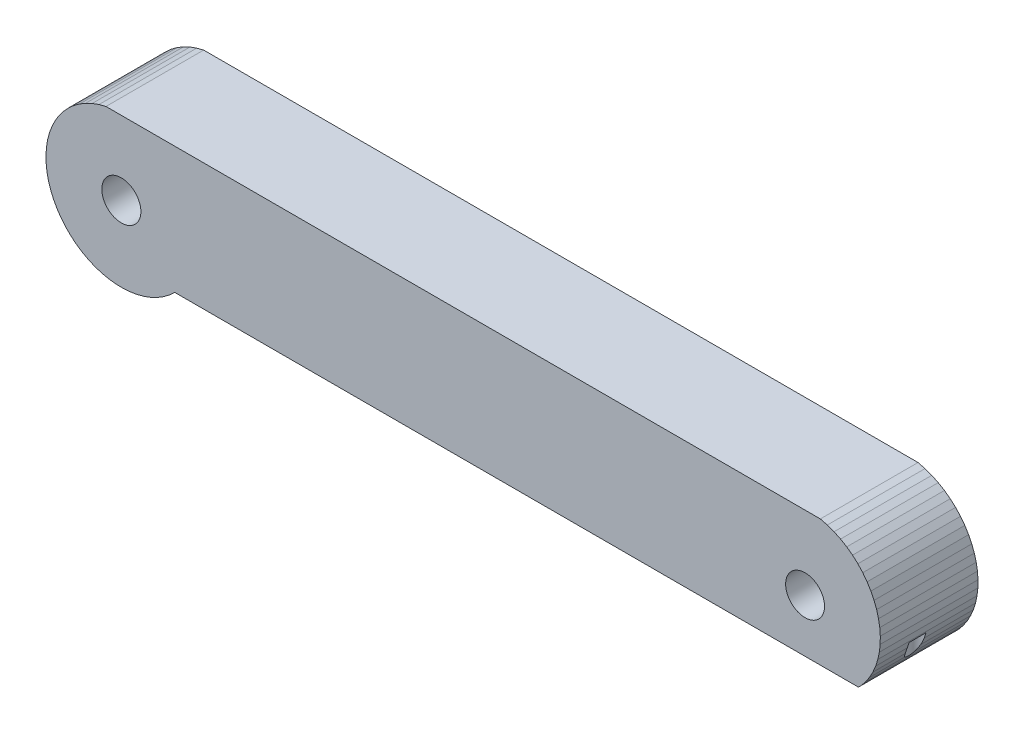
from build123d import *
from OCP.BRepAlgoAPI import BRepAlgoAPI_Cut
from OCP.TopTools import TopTools_ListOfShape

# Parameters (mm, degrees)
BOSS_EXTRUDE1_DEPTH      = 19.999999553
CUT_EXTRUDE1_DEPTH       = 158.4379932
CUT_EXTRUDE2_DEPTH       = 158.4379932
SKETCH7_W                = 17.271465807
SKETCH7_H                = 13.849760317
SKETCH7_W_2              = 14.338575387
SKETCH7_H_2              = 12.546253463
BOSS_EXTRUDE4_DEPTH      = 20
SKETCH6_R                = 3.997536833
SKETCH6_R_2              = 3.982936498
CUT_EXTRUDE4_DEPTH       = 20
SPLIT1_SURFACE_1_BACK    = 175.651
SPLIT1_SURFACE_1_DEPTH   = 351.302
SPLIT1_SURFACE_2_BACK    = 175.651
SPLIT1_SURFACE_2_DEPTH   = 351.302
BODY_DELETE_KEEP_3_DEPTH = 19.999999553
SKETCH15_R               = 1.744345672
CUT_EXTRUDE8_DEPTH       = 6.604
SKETCH18_R               = 1.524
CUT_EXTRUDE10_DEPTH      = 6.604
SKETCH21_R               = 1.524
CUT_EXTRUDE12_DEPTH      = 6.604


with BuildPart() as part:
    # Sketch1 → Boss-Extrude1 (new body)
    with BuildSketch(Plane.XY.offset(19.999999553)):
        Polygon((-147.262692451, 13.588201255), (-148.526370525, 12.833039276), (-149.712219834, 11.960721575), (-150.809392333, 10.979211889), (-151.807874441, 9.897469543), (-152.69857645, 8.725371212), (-153.473347425, 7.473616395), (-154.125109315, 6.153633818), (-154.647916555, 4.777472466), (-155.037015676, 3.357697045), (-155.2888304, 1.907268073), (-155.401065946, 0.439427269), (-155.372709036, -1.032425207), (-155.203998089, -2.494852291), (-154.896497726, -3.934503533), (-154.453009367, -5.338235293), (-153.877556324, -6.69323327), (-153.175413609, -7.987127639), (-152.353018522, -9.208105505), (-151.417821646, -10.3450194), (-150.378391147, -11.387491599), (-149.244219065, -12.326003984), (-148.025646806, -13.15199025), (-146.733820438, -13.857908547), (-145.38051188, -14.437315054), (-143.978089094, -14.884918928), (-142.539337277, -15.196635388), (-141.077414155, -15.36961738), (-139.605656266, -15.402286313), (-138.137474656, -15.294345096), (-136.686325073, -15.046778135), (-135.265409946, -14.661843888), (-133.887723088, -14.143059961), (-132.565841079, -13.495159335), (-131.311833858, -12.724057771), (-130.137130618, -11.836796999), (-129.052475095, -10.841473937), (-10.947530158, -10.841473937), (-9.862869047, -11.836796999), (-8.688169532, -12.724057771), (-7.434152998, -13.495159335), (-6.112268195, -14.143059961), (-4.734582733, -14.661843888), (-3.313674591, -15.046778135), (-1.862514997, -15.294345096), (-0.394351926, -15.402286313), (1.077411231, -15.36961738), (2.539338311, -15.196635388), (3.978083376, -14.884918928), (5.380511284, -14.437315054), (6.733819377, -13.857908547), (8.025652729, -13.15199025), (9.244217537, -12.326003984), (10.378391482, -11.387491599), (11.417816393, -10.3450194), (12.35300675, -9.208105505), (13.175422326, -7.987127639), (13.877556659, -6.69323327), (14.453000389, -5.338235293), (14.896498062, -3.934503533), (15.204001218, -2.494852291), (15.372704715, -1.032425207), (15.401067212, 0.439427269), (15.288828872, 1.907268073), (15.03701508, 3.357697045), (14.647925273, 4.777472466), (14.125110582, 6.153633818), (13.473344967, 7.473616395), (12.698576786, 8.725371212), (11.807881296, 9.897469543), (10.809388012, 10.979211889), (9.71221365, 11.960721575), (8.526373655, 12.833039276), (7.262694649, 13.588201255), (5.932712927, 14.21931386), (4.548569676, 14.720613137), (3.122901777, 15.087526292), (-143.122896552, 15.087526292), (-144.548565149, 14.720613137), (-145.93270421, 14.21931386), align=None)
    extrude(amount=-BOSS_EXTRUDE1_DEPTH)

    # Sketch2 → Cut-Extrude1 (cut, through all)
    with BuildSketch(Plane(origin=(0, 0, 0), x_dir=(-1, 0, 0), z_dir=(0, 0, -1))):
        Polygon((138.905346394, 3.847302636), (138.217046857, 3.580653109), (137.589469552, 3.192068776), (137.043967843, 2.694782568), (136.599138379, 2.105728723), (136.270105839, 1.444966649), (136.068105698, 0.73499803), (136.000007391, 0), (136.068105698, -0.73499803), (136.270105839, -1.444966649), (136.599138379, -2.105728723), (137.043967843, -2.694782568), (137.589469552, -3.192068776), (138.217046857, -3.580653109), (138.905346394, -3.847302636), (139.630913734, -3.982936498), (140.369072556, -3.982936498), (141.094654799, -3.847302636), (141.782954335, -3.580653109), (142.41053164, -3.192068776), (142.956033349, -2.694782568), (143.400862813, -2.105728723), (143.729895353, -1.444966649), (143.931895494, -0.73499803), (143.999993801, 0), (143.931895494, 0.73499803), (143.729895353, 1.444966649), (143.400862813, 2.105728723), (142.956033349, 2.694782568), (142.41053164, 3.192068776), (141.782954335, 3.580653109), (141.094654799, 3.847302636), (140.369072556, 3.982936498), (139.630913734, 3.982936498), align=None)
    extrude(amount=-CUT_EXTRUDE1_DEPTH, mode=Mode.SUBTRACT)

    # Sketch3 → Cut-Extrude2 (cut, through all)
    with BuildSketch(Plane(origin=(0, 0, 0), x_dir=(-1, 0, 0), z_dir=(0, 0, -1))):
        Polygon((-2.956035547, 2.694782568), (-3.400868736, 2.105728723), (-3.729888937, 1.444966649), (-3.93189257, 0.73499803), (-4.00000019, 0), (-3.93189257, -0.73499803), (-3.729888937, -1.444966649), (-3.400868736, -2.105728723), (-2.956035547, -2.694782568), (-2.410538495, -3.192068776), (-1.78295339, -3.580653109), (-1.094651991, -3.847302636), (-0.369073445, -3.982936498), (0.369073445, -3.982936498), (1.094651991, -3.847302636), (1.78295339, -3.580653109), (2.410538495, -3.192068776), (2.956035547, -2.694782568), (3.400868736, -2.105728723), (3.729888937, -1.444966649), (3.93189257, -0.73499803), (4.00000019, 0), (3.93189257, 0.73499803), (3.729888937, 1.444966649), (3.400868736, 2.105728723), (2.956035547, 2.694782568), (2.410538495, 3.192068776), (1.78295339, 3.580653109), (1.094651991, 3.847302636), (0.369073445, 3.982936498), (-0.369073445, 3.982936498), (-1.094651991, 3.847302636), (-1.78295339, 3.580653109), (-2.410538495, 3.192068776), align=None)
    extrude(amount=-CUT_EXTRUDE2_DEPTH, mode=Mode.SUBTRACT)

    # Sketch7 → Boss-Extrude4 (add)
    with BuildSketch(Plane.XY):
        with Locations((-138.922924236, -1.542356043)):
            Rectangle(SKETCH7_W, SKETCH7_H)
        with Locations((0.715247426, -0.890602616)):
            Rectangle(SKETCH7_W_2, SKETCH7_H_2)
    extrude(amount=BOSS_EXTRUDE4_DEPTH)


with BuildPart() as cut_extrude4_tool:
    # Sketch6 → Cut-Extrude4 (new body)
    with BuildSketch(Plane.XY.offset(19.999999553)):
        with Locations((-139.974139817, 0.010018843)):
            Circle(SKETCH6_R)
        with Locations((-5.81e-07, 0)):
            Circle(SKETCH6_R_2)
    extrude(amount=-CUT_EXTRUDE4_DEPTH)


with BuildPart() as part_1:
    add(part.part)

    # Cut-Extrude4: cut by cut_extrude4_tool, with a tolerance
    cut_extrude4_stock = TopTools_ListOfShape()
    cut_extrude4_stock.Append(part_1.part.wrapped)
    cut_extrude4_tools = TopTools_ListOfShape()
    cut_extrude4_tools.Append(cut_extrude4_tool.part.wrapped)
    cut_extrude4_cut = BRepAlgoAPI_Cut()
    cut_extrude4_cut.SetArguments(cut_extrude4_stock)
    cut_extrude4_cut.SetTools(cut_extrude4_tools)
    cut_extrude4_cut.SetFuzzyValue(0.00001)
    cut_extrude4_cut.Build()
    add(Compound.cast(cut_extrude4_cut.Shape()).solids(), mode=Mode.REPLACE)


with BuildPart() as body_2:
    # Split1: the piece behind the surface
    add(part_1.part)
    # Split1 surface: a surface, the sketch's curves swept straight by 351.302 mm
    with BuildLine(Plane.XY.offset(-SPLIT1_SURFACE_1_BACK), mode=Mode.PRIVATE) as split1_surface_1_path:
        Line((-163.891257917, -10.841473937), (71.448565983, -10.841473937))
    split1_surface_1 = Shell.extrude(split1_surface_1_path.wire(), (0 * SPLIT1_SURFACE_1_DEPTH, 0 * SPLIT1_SURFACE_1_DEPTH, 1 * SPLIT1_SURFACE_1_DEPTH))
    split(bisect_by=split1_surface_1, keep=Keep.BOTTOM)

    # Body-Delete/Keep 3: read off the stored shape, not the designer's step
    # Body-Delete/Keep 3 outline → Body-Delete/Keep 3 (cut)
    with BuildSketch(Plane.XY):
        Polygon((10.92281306, -10.841473937), (-10.947530158, -10.841473937), (-9.862869047, -11.836796999), (-8.688169532, -12.724057771), (-7.434152998, -13.495159335), (-6.112268195, -14.143059961), (-4.734582733, -14.661843888), (-3.313674591, -15.046778135), (-1.862514997, -15.294345096), (-0.394351926, -15.402286313), (1.077411231, -15.36961738), (2.539338311, -15.196635388), (3.978083376, -14.884918928), (5.380511284, -14.437315054), (6.733819377, -13.857908547), (8.025652729, -13.15199025), (9.244217537, -12.326003984), (10.378391482, -11.387491599), align=None)
    extrude(amount=BODY_DELETE_KEEP_3_DEPTH, mode=Mode.SUBTRACT)


with BuildPart() as part_2:
    add(part_1.part)

    # Split1: split by a surface, the side it looks to stays
    # Split1 surface: a surface, the sketch's curves swept straight by 351.302 mm
    with BuildLine(Plane.XY.offset(-SPLIT1_SURFACE_2_BACK), mode=Mode.PRIVATE) as split1_surface_2_path:
        Line((-163.891257917, -10.841473937), (71.448565983, -10.841473937))
    split1_surface_2 = Shell.extrude(split1_surface_2_path.wire(), (0 * SPLIT1_SURFACE_2_DEPTH, 0 * SPLIT1_SURFACE_2_DEPTH, 1 * SPLIT1_SURFACE_2_DEPTH))
    split(bisect_by=split1_surface_2, keep=Keep.TOP)

    # Combine1: union body 2
    add(body_2.part)

    # Sketch15 → Cut-Extrude8 (cut)
    with BuildSketch(Plane(origin=(572.8274653, -10.841473937, -774.382334298), x_dir=(-1, 0, 0), z_dir=(0, -1, 0))):
        with Locations((558.238583002, -786.161559021)):
            Circle(SKETCH15_R)
    extrude(amount=-CUT_EXTRUDE8_DEPTH, mode=Mode.SUBTRACT)

    # Sketch18 → Cut-Extrude10 (cut)
    with BuildSketch(Plane(origin=(572.8274653, -10.841473937, -774.382334298), x_dir=(-1, 0, 0), z_dir=(0, -1, 0))):
        with Locations(Location((569.02222175, -785.202893663, 0), (0, 0, 90))):
            Circle(SKETCH18_R)
    extrude(amount=-CUT_EXTRUDE10_DEPTH, mode=Mode.SUBTRACT)

    # Sketch21 → Cut-Extrude12 (cut)
    with BuildSketch(Plane(origin=(572.8274653, -10.841473937, -774.382334298), x_dir=(-1, 0, 0), z_dir=(0, -1, 0))):
        with Locations(Location((612.380347085, -785.422094839, 0), (0, 0, 90))):
            Circle(SKETCH21_R)
    extrude(amount=-CUT_EXTRUDE12_DEPTH, mode=Mode.SUBTRACT)


solid = part_2.part
